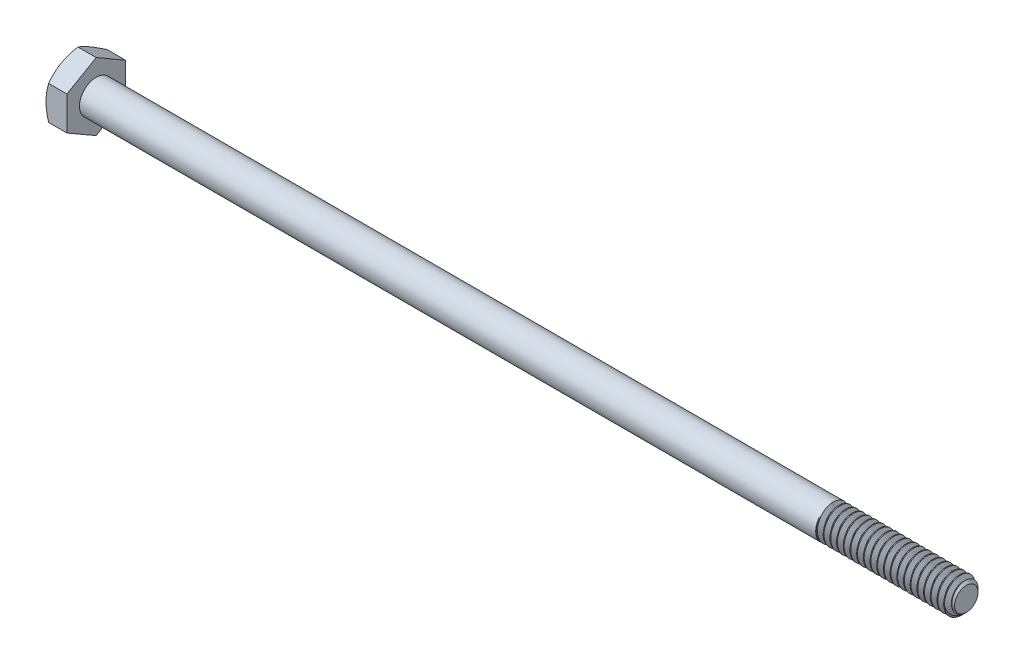
from build123d import *

# Parameters (mm, degrees)
SKETCH5_R           = 3.175
BOSS_EXTRUDE3_DEPTH = 165.1
CHAMFER1_SIZE       = 0.9525
BOSS_EXTRUDE4_DEPTH = 3.96875
SKETCH8_OUTSIDE_W   = 636.968
SKETCH8_OUTSIDE_H   = 638.688
SKETCH8_OUTSIDE_R   = 5.55625
CUT_EXTRUDE3_DEPTH  = 170.281649013
CUT_EXTRUDE3_DRAFT  = -60
CUT_EXTRUDE4_DEPTH  = 0.254
CIRPATTERN1_COUNT   = 6
CUT_SWEEP1_PITCH    = 1.27
CUT_SWEEP1_TO       = 25.4


with BuildPart() as part:
    # Sketch5 → Boss-Extrude3 (new body)
    with BuildSketch(Plane(origin=(84.534375, 0, 0), x_dir=(0, 0, -1), z_dir=(1, 0, 0))):
        Circle(SKETCH5_R)
    extrude(amount=-BOSS_EXTRUDE3_DEPTH)

    # Chamfer1
    chamfer1_edges = [part.edges().sort_by_distance(p)[0] for p in [
        (84.534375, 0, 3.175),
    ]]
    chamfer(chamfer1_edges, length=CHAMFER1_SIZE)

    # Sketch11 → Revolve1 (revolve)
    with BuildSketch(Plane.XY):
        Polygon((-80.565625, 3.175), (-80.565625, 0), (68.659375, 0), (65.484375, 3.175), align=None)
    revolve(axis=Axis((-80.565625, 0, 0), (1, 0, 0)))

    # Sketch6 → Boss-Extrude4 (add)
    with BuildSketch(Plane.ZY.offset(80.565625)):
        Polygon((5.55625, 3.207902433), (0, 6.415804866), (-5.55625, 3.207902433), (-5.55625, -3.207902433), (0, -6.415804866), (5.55625, -3.207902433), align=None)
    extrude(amount=BOSS_EXTRUDE4_DEPTH)


with BuildPart() as cut_extrude3_tool:
    # Sketch8 outside → Cut-Extrude3 (with draft: the straight prism first)
    with BuildSketch(Plane.ZY.offset(84.534375)):
        Rectangle(SKETCH8_OUTSIDE_W, SKETCH8_OUTSIDE_H)
        Circle(SKETCH8_OUTSIDE_R, mode=Mode.SUBTRACT)
    extrude(amount=-CUT_EXTRUDE3_DEPTH)
    # Cut-Extrude3: the draft: its side faces are tilted about the plane it starts from
    cut_extrude3_sides = [cut_extrude3_tool.faces().sort_by_distance(p)[0] for p in [
        (0.606449507, -319.344, 0),
        (0.606449507, 0, 318.484),
        (0.606449507, 319.344, 0),
        (0.606449507, 0, -318.484),
        (0.606449507, 0, -5.55625),
    ]]
    draft(cut_extrude3_sides, Plane.ZY.offset(84.534375), CUT_EXTRUDE3_DRAFT)


with BuildPart() as part_1:
    add(part.part)

    # Cut-Extrude3: cut by cut_extrude3_tool
    add(cut_extrude3_tool.part, mode=Mode.SUBTRACT)

    # Sketch12 → Cut-Extrude4 (cut)
    with BuildSketch(Plane.ZY.offset(84.534375)):
        with BuildLine():
            Line((0.1666875, 4.2783125), (0.1666875, 2.3891875))
            ThreePointArc((0.1666875, 2.3891875), (0, 2.2225), (-0.1666875, 2.3891875))
            Line((-0.1666875, 2.3891875), (-0.1666875, 4.2783125))
            ThreePointArc((-0.1666875, 4.2783125), (0, 4.445), (0.1666875, 4.2783125))
        make_face()
    cut_extrude4 = extrude(amount=-CUT_EXTRUDE4_DEPTH, mode=Mode.SUBTRACT)

    # CirPattern1: Cut-Extrude4 ×6 about axis
    cirpattern1_axis = Axis((0, 0, 0), (1, 0, 0))
    for i in range(1, CIRPATTERN1_COUNT):
        add(cut_extrude4.rotate(cirpattern1_axis, i * 360 / CIRPATTERN1_COUNT), mode=Mode.SUBTRACT)


with BuildPart() as body_2:
    # Split1: the piece on the far side of the plane
    add(part_1.part)
    split(bisect_by=Plane(origin=(59.134375, 0, 0), x_dir=(0, 0, 1), z_dir=(1, 0, 0)), keep=Keep.BOTTOM)


with BuildPart() as part_2:
    add(part_1.part)

    # Split1
    split(bisect_by=Plane(origin=(59.134375, 0, 0), x_dir=(0, 0, 1), z_dir=(1, 0, 0)), keep=Keep.TOP)

    # Cut-Sweep1: arcs per turn and ends read off the stored shape
    # Cut-Sweep1: the profile of Sketch10 profile screwed along a right-hand helix through 21 turns, 8 arcs to a turn; built about Z, then put on its axis
    cut_sweep1_z = Axis((0, 0, 0), (0, 0, 1))
    cut_sweep1_corners = [(3.1753, 0, 0.000173205), (2.350110803, 0, -0.47625), (2.350110803, 0, -0.635), (3.1753, 0, -1.111423205)]
    with BuildLine(mode=Mode.PRIVATE) as cut_sweep1_profile:
        Line(cut_sweep1_corners[0], cut_sweep1_corners[1])
        Line(cut_sweep1_corners[1], cut_sweep1_corners[2])
        Line(cut_sweep1_corners[2], cut_sweep1_corners[3])
        Line(cut_sweep1_corners[3], cut_sweep1_corners[0])
    cut_sweep1_cap = Face(cut_sweep1_profile.wire())
    cut_sweep1_turn_angles = [0, 22.5, 45, 67.5, 90, 112.5, 135, 157.5, 180, 202.5, 225, 247.5, 270, 292.5, 315, 337.5, 360]
    cut_sweep1_turn_weights = [1, 0.9238795325112867, 1, 0.9238795325112867, 1, 0.9238795325112867, 1, 0.9238795325112867, 1, 0.9238795325112867, 1, 0.9238795325112867, 1, 0.9238795325112867, 1, 0.9238795325112867, 1]
    cut_sweep1_turn_rails = [Edge.make_bspline([Vector(p[0], p[1], 0).rotate(cut_sweep1_z, cut_sweep1_turn_angles[k]) / cut_sweep1_turn_weights[k] + Vector(0, 0, p[2] + CUT_SWEEP1_PITCH * cut_sweep1_turn_angles[k] / 360) for k in range(17)], [0, 0, 0, 1, 1, 2, 2, 3, 3, 4, 4, 5, 5, 6, 6, 7, 7, 8, 8, 8], 2, cut_sweep1_turn_weights) for p in cut_sweep1_corners]
    cut_sweep1_turn_sides = [Face.make_surface_from_curves(cut_sweep1_turn_rails[p[0]], cut_sweep1_turn_rails[p[1]]) for p in [(0, 1), (1, 2), (2, 3), (3, 0)]]
    cut_sweep1 = Plane(origin=(84.534375, 0, 0), x_dir=(0, 1, 0), z_dir=(-1, 0, 0)) * split(Solid(Shell([*[p.moved(Location((0, 0, CUT_SWEEP1_PITCH * i))) for i in range(21) for p in cut_sweep1_turn_sides], cut_sweep1_cap, cut_sweep1_cap.rotate(cut_sweep1_z, 7560).moved(Location((0, 0, CUT_SWEEP1_PITCH * 7560 / 360)))])), bisect_by=Plane.XY.offset(CUT_SWEEP1_TO), keep=Keep.BOTTOM, mode=Mode.PRIVATE)
    add(cut_sweep1, mode=Mode.SUBTRACT)


with BuildPart() as boss_extrude5_tool:
    # Boss-Extrude5: read off the stored shape, not the designer's step
    # Boss-Extrude5 outline → Boss-Extrude5 (revolve)
    with BuildSketch(Plane.YX):
        Polygon((3.175, 59.134375), (2.35010135, 59.610630458), (2.35010135, 59.134375), align=None)
    revolve(axis=Axis((0, 0, 0), (1, 0, 0)))


with BuildPart() as part_3:
    add(part_2.part)


with BuildPart() as part_4:
    # Boss-Extrude5: joined with boss_extrude5_tool
    add(part_3.part.fuse(boss_extrude5_tool.part, body_2.part, tol=0.00001))


solid = part_4.part
